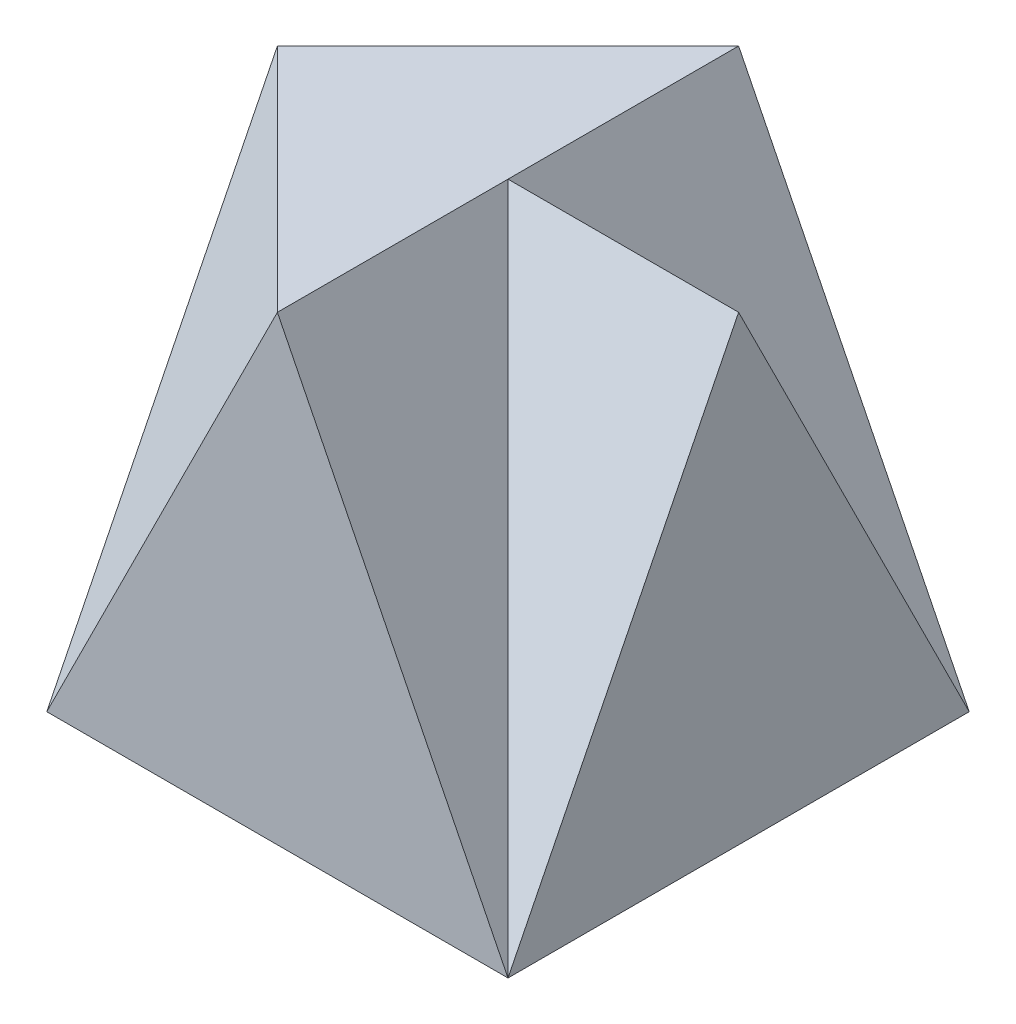
from build123d import *

# Parameters (mm, degrees)
SKETCH2_W           = 4
SKETCH2_H           = 4
BOSS_EXTRUDE1_DEPTH = 4
CUT_EXTRUDE4_START  = -0.894427191
CUT_EXTRUDE4_DEPTH  = 4.472135955
CUT_EXTRUDE9_DEPTH  = 10
CUT_EXTRUDE10_DEPTH = 10


# Read off the part's stored shape, not the designer's step: Cut-Extrude4
with BuildPart() as part:
    # Sketch2 → Boss-Extrude1 (new body)
    with BuildSketch(Plane(origin=(0, 0, 0), x_dir=(1, 0, 0), z_dir=(0, 1, 0))):
        Rectangle(SKETCH2_W, SKETCH2_H)
    extrude(amount=BOSS_EXTRUDE1_DEPTH)

    # Cut-Extrude4 outline → Cut-Extrude4 (cut)
    with BuildSketch(Plane(origin=(0, 0, 0), x_dir=(0.8944271909999155, -0.4472135954999585, 0), z_dir=(0.4472135954999585, 0.8944271909999156, 0)).offset(CUT_EXTRUDE4_START)):
        Polygon((-1.788854382, -2), (-3.577708764, 0), (-1.788854382, 2), (-5, 2), (-5, -2), align=None)
    extrude(amount=CUT_EXTRUDE4_DEPTH, mode=Mode.SUBTRACT)

    # 3DSketch4 → Cut-Extrude9 (cut, along a direction that is not the sketch's normal)
    with BuildSketch(Plane(origin=(2, 0, 2), x_dir=(-0.4082482904638631, 0.8164965809277261, -0.4082482904638631), z_dir=(0, -0.447213595499958, -0.894427190999916))):
        Polygon((0, 0), (4.898979486, 0), (4.082482905, 1.825741858), align=None)
    extrude(amount=-CUT_EXTRUDE9_DEPTH, dir=(0, 0, -1), mode=Mode.SUBTRACT)

    # 3DSketch5 → Cut-Extrude10 (cut, along a direction that is not the sketch's normal)
    with BuildSketch(Plane(origin=(0, 4, 0), x_dir=(0.4082482904638631, -0.8164965809277261, -0.4082482904638631), z_dir=(0, -0.447213595499958, 0.8944271909999159))):
        Polygon((0, 0), (4.898979486, 0), (0.816496581, 1.825741858), align=None)
    extrude(amount=-CUT_EXTRUDE10_DEPTH, dir=(0, 0, 1), mode=Mode.SUBTRACT)


solid = part.part
